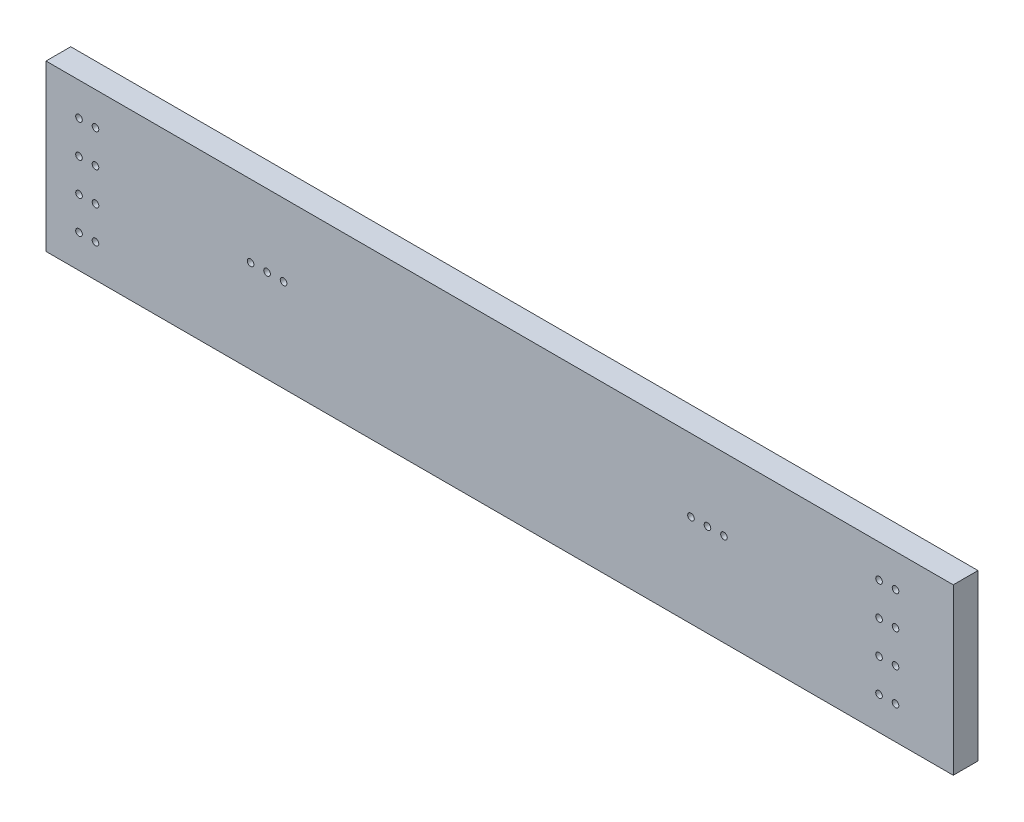
from build123d import *

# Parameters (mm, degrees)
SKETCH1_W           = 698.5
SKETCH1_H           = 127
BOSS_EXTRUDE1_DEPTH = 19.05
SKETCH2_R           = 2.54
CUT_EXTRUDE1_DEPTH  = 356.486589058


with BuildPart() as part:
    # Sketch1 → Boss-Extrude1 (new body)
    with BuildSketch(Plane.XY):
        Rectangle(SKETCH1_W, SKETCH1_H)
    extrude(amount=BOSS_EXTRUDE1_DEPTH)

    # Sketch2 → Cut-Extrude1 (cut, through all)
    with BuildSketch(Plane.XY.offset(19.05)):
        with Locations((304.8, 38.1)):
            Circle(SKETCH2_R)
        with Locations((304.8, 12.7)):
            Circle(SKETCH2_R)
        with Locations((304.8, -12.7)):
            Circle(SKETCH2_R)
        with Locations((304.8, -38.1)):
            Circle(SKETCH2_R)
        with Locations((292.1, -38.1)):
            Circle(SKETCH2_R)
        with Locations((292.1, -12.7)):
            Circle(SKETCH2_R)
        with Locations((292.1, 12.7)):
            Circle(SKETCH2_R)
        with Locations((292.1, 38.1)):
            Circle(SKETCH2_R)
        with Locations((-323.85, 38.1)):
            Circle(SKETCH2_R)
        with Locations((-311.15, 38.1)):
            Circle(SKETCH2_R)
        with Locations((-323.85, 12.7)):
            Circle(SKETCH2_R)
        with Locations((-311.15, 12.7)):
            Circle(SKETCH2_R)
        with Locations((-323.85, -12.7)):
            Circle(SKETCH2_R)
        with Locations((-311.15, -12.7)):
            Circle(SKETCH2_R)
        with Locations((-323.85, -38.1)):
            Circle(SKETCH2_R)
        with Locations((-311.15, -38.1)):
            Circle(SKETCH2_R)
        with Locations((147.32, 7.8105)):
            Circle(SKETCH2_R)
        with Locations((160.02, 7.8105)):
            Circle(SKETCH2_R)
        with Locations((172.72, 7.8105)):
            Circle(SKETCH2_R)
        with Locations((-191.77, 7.8105)):
            Circle(SKETCH2_R)
        with Locations((-179.07, 7.8105)):
            Circle(SKETCH2_R)
        with Locations((-166.37, 7.8105)):
            Circle(SKETCH2_R)
    extrude(amount=-CUT_EXTRUDE1_DEPTH, mode=Mode.SUBTRACT)


solid = part.part
